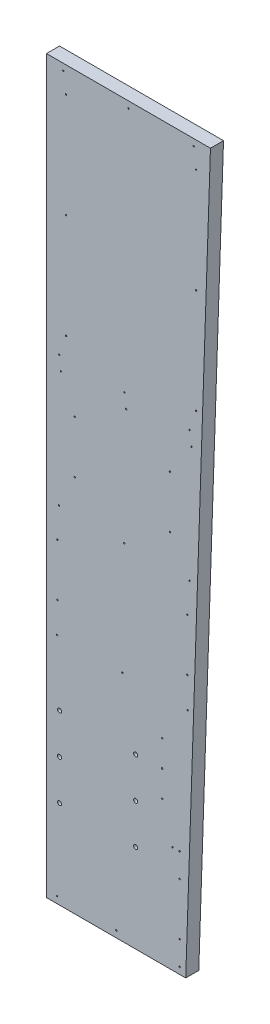
from build123d import *

# Parameters (mm, degrees)
STOCK_LEFT_START                    = 2664.46
STOCK_LEFT_CONSOLE_1_OUTLINE_R      = 2.286
STOCK_LEFT_CONSOLE_1_OUTLINE_R_2    = 2.413
STOCK_LEFT_CONSOLE_1_DEPTH          = 19.05
BOSS_EXTRUDE1_DEPTH                 = 19.05
HOLE2_D                             = 1.98374
HOLE2_CSINK_D                       = 10.16
HOLE2_CSINK_ANGLE                   = 82
F_5_64_0_07813_DIAMETER_HOLE1_D     = 1.984502
F_5_64_0_07813_DIAMETER_HOLE1_DEPTH = 38.1
F_5_64_0_07813_DIAMETER_HOLE1_TIP   = 0.59620455
F_15_64_0_23438_DIAMETER_HOLE1_D    = 5.953252


# Read off the part's stored shape, not the designer's step: Stock-Left Console-1
with BuildPart() as part:
    # Stock-Left Console-1 outline → Stock-Left Console-1 (new body)
    with BuildSketch(Plane.XY.offset(STOCK_LEFT_START)):
        Polygon((266.7, 5935.98), (469.880491555, 5935.980000144), (505.978496548, 7002.779994921), (266.7, 7002.779994921), align=None)
        with Locations((292.1, 5974.08)):
            Circle(STOCK_LEFT_CONSOLE_1_OUTLINE_R, mode=Mode.SUBTRACT)
        with Locations((292.1, 5999.48)):
            Circle(STOCK_LEFT_CONSOLE_1_OUTLINE_R, mode=Mode.SUBTRACT)
        with Locations((292.1, 6037.58)):
            Circle(STOCK_LEFT_CONSOLE_1_OUTLINE_R, mode=Mode.SUBTRACT)
        with Locations((292.1, 6062.980000075)):
            Circle(STOCK_LEFT_CONSOLE_1_OUTLINE_R, mode=Mode.SUBTRACT)
        with Locations((317.5, 5974.08)):
            Circle(STOCK_LEFT_CONSOLE_1_OUTLINE_R, mode=Mode.SUBTRACT)
        with Locations((317.5, 6062.980000075)):
            Circle(STOCK_LEFT_CONSOLE_1_OUTLINE_R, mode=Mode.SUBTRACT)
        with Locations((292.1, 6120.129999958)):
            Circle(STOCK_LEFT_CONSOLE_1_OUTLINE_R, mode=Mode.SUBTRACT)
        with Locations((292.1, 6145.529999958)):
            Circle(STOCK_LEFT_CONSOLE_1_OUTLINE_R, mode=Mode.SUBTRACT)
        with Locations((317.5, 6120.129999958)):
            Circle(STOCK_LEFT_CONSOLE_1_OUTLINE_R, mode=Mode.SUBTRACT)
        with Locations((292.1, 6221.73000008)):
            Circle(STOCK_LEFT_CONSOLE_1_OUTLINE_R, mode=Mode.SUBTRACT)
        with Locations((292.1, 6247.130000155)):
            Circle(STOCK_LEFT_CONSOLE_1_OUTLINE_R, mode=Mode.SUBTRACT)
        with Locations((292.1, 6304.280000038)):
            Circle(STOCK_LEFT_CONSOLE_1_OUTLINE_R, mode=Mode.SUBTRACT)
        with Locations((292.1, 6329.680000038)):
            Circle(STOCK_LEFT_CONSOLE_1_OUTLINE_R, mode=Mode.SUBTRACT)
        with Locations((317.5, 6247.130000155)):
            Circle(STOCK_LEFT_CONSOLE_1_OUTLINE_R, mode=Mode.SUBTRACT)
        with Locations((317.5, 6304.280000038)):
            Circle(STOCK_LEFT_CONSOLE_1_OUTLINE_R, mode=Mode.SUBTRACT)
        with Locations((292.1, 6386.830000042)):
            Circle(STOCK_LEFT_CONSOLE_1_OUTLINE_R, mode=Mode.SUBTRACT)
        with Locations((292.1, 6412.230000117)):
            Circle(STOCK_LEFT_CONSOLE_1_OUTLINE_R, mode=Mode.SUBTRACT)
        with Locations((317.5, 6412.230000117)):
            Circle(STOCK_LEFT_CONSOLE_1_OUTLINE_R, mode=Mode.SUBTRACT)
        with Locations((450.85, 5974.080000054)):
            Circle(STOCK_LEFT_CONSOLE_1_OUTLINE_R, mode=Mode.SUBTRACT)
        with Locations((450.85, 5999.48)):
            Circle(STOCK_LEFT_CONSOLE_1_OUTLINE_R, mode=Mode.SUBTRACT)
        with Locations((450.85, 6037.579999958)):
            Circle(STOCK_LEFT_CONSOLE_1_OUTLINE_R, mode=Mode.SUBTRACT)
        with Locations((450.85, 6062.979999958)):
            Circle(STOCK_LEFT_CONSOLE_1_OUTLINE_R, mode=Mode.SUBTRACT)
        with Locations((450.85, 6120.129999928)):
            Circle(STOCK_LEFT_CONSOLE_1_OUTLINE_R, mode=Mode.SUBTRACT)
        with Locations((450.85, 6145.529999873)):
            Circle(STOCK_LEFT_CONSOLE_1_OUTLINE_R, mode=Mode.SUBTRACT)
        with Locations((450.85, 6221.730000038)):
            Circle(STOCK_LEFT_CONSOLE_1_OUTLINE_R, mode=Mode.SUBTRACT)
        with Locations((450.85, 6247.130000038)):
            Circle(STOCK_LEFT_CONSOLE_1_OUTLINE_R, mode=Mode.SUBTRACT)
        with Locations((450.85, 6304.280000008)):
            Circle(STOCK_LEFT_CONSOLE_1_OUTLINE_R, mode=Mode.SUBTRACT)
        with Locations((450.85, 6329.679999954)):
            Circle(STOCK_LEFT_CONSOLE_1_OUTLINE_R, mode=Mode.SUBTRACT)
        with Locations((450.85, 6386.83)):
            Circle(STOCK_LEFT_CONSOLE_1_OUTLINE_R, mode=Mode.SUBTRACT)
        with Locations((450.85, 6412.23)):
            Circle(STOCK_LEFT_CONSOLE_1_OUTLINE_R, mode=Mode.SUBTRACT)
        with Locations((292.1, 6469.379999916)):
            Circle(STOCK_LEFT_CONSOLE_1_OUTLINE_R, mode=Mode.SUBTRACT)
        with Locations((292.1, 6494.779999916)):
            Circle(STOCK_LEFT_CONSOLE_1_OUTLINE_R, mode=Mode.SUBTRACT)
        with Locations((292.1, 6557.6958)):
            Circle(STOCK_LEFT_CONSOLE_1_OUTLINE_R, mode=Mode.SUBTRACT)
        with Locations((292.1, 6583.095800075)):
            Circle(STOCK_LEFT_CONSOLE_1_OUTLINE_R, mode=Mode.SUBTRACT)
        with Locations((317.5, 6469.379999916)):
            Circle(STOCK_LEFT_CONSOLE_1_OUTLINE_R, mode=Mode.SUBTRACT)
        with Locations((317.5, 6583.095800075)):
            Circle(STOCK_LEFT_CONSOLE_1_OUTLINE_R, mode=Mode.SUBTRACT)
        with Locations((304.799999998, 6667.141886848)):
            Circle(STOCK_LEFT_CONSOLE_1_OUTLINE_R_2, mode=Mode.SUBTRACT)
        with Locations((304.799999998, 6692.541886848)):
            Circle(STOCK_LEFT_CONSOLE_1_OUTLINE_R_2, mode=Mode.SUBTRACT)
        with Locations((330.199999998, 6667.141886848)):
            Circle(STOCK_LEFT_CONSOLE_1_OUTLINE_R_2, mode=Mode.SUBTRACT)
        with Locations((330.199999998, 6692.541886848)):
            Circle(STOCK_LEFT_CONSOLE_1_OUTLINE_R_2, mode=Mode.SUBTRACT)
        with Locations((304.8, 6939.27999014)):
            Circle(STOCK_LEFT_CONSOLE_1_OUTLINE_R, mode=Mode.SUBTRACT)
        with Locations((304.8, 6964.679990215)):
            Circle(STOCK_LEFT_CONSOLE_1_OUTLINE_R, mode=Mode.SUBTRACT)
        with Locations((330.2, 6964.679990215)):
            Circle(STOCK_LEFT_CONSOLE_1_OUTLINE_R, mode=Mode.SUBTRACT)
        with Locations((450.85, 6469.37999997)):
            Circle(STOCK_LEFT_CONSOLE_1_OUTLINE_R, mode=Mode.SUBTRACT)
        with Locations((450.85, 6494.779999916)):
            Circle(STOCK_LEFT_CONSOLE_1_OUTLINE_R, mode=Mode.SUBTRACT)
        with Locations((450.85, 6557.6958)):
            Circle(STOCK_LEFT_CONSOLE_1_OUTLINE_R, mode=Mode.SUBTRACT)
        with Locations((450.85, 6583.0958)):
            Circle(STOCK_LEFT_CONSOLE_1_OUTLINE_R, mode=Mode.SUBTRACT)
        with Locations((476.25, 6667.141886848)):
            Circle(STOCK_LEFT_CONSOLE_1_OUTLINE_R, mode=Mode.SUBTRACT)
        with Locations((476.25, 6692.541886848)):
            Circle(STOCK_LEFT_CONSOLE_1_OUTLINE_R, mode=Mode.SUBTRACT)
        with Locations((476.25, 6939.27999014)):
            Circle(STOCK_LEFT_CONSOLE_1_OUTLINE_R, mode=Mode.SUBTRACT)
        with Locations((476.25, 6964.67999014)):
            Circle(STOCK_LEFT_CONSOLE_1_OUTLINE_R, mode=Mode.SUBTRACT)
    extrude(amount=STOCK_LEFT_CONSOLE_1_DEPTH)

    # Sketch1 → Boss-Extrude1 (add)
    with BuildSketch(Plane(origin=(0, 0, 2664.46), x_dir=(-1, 0, 0), z_dir=(0, 0, -1))):
        Polygon((-266.7, 5935.980000036), (-266.7, 7002.779994921), (-505.978496548, 7002.779994921), (-469.880491555, 5935.980000144), align=None)
    extrude(amount=-BOSS_EXTRUDE1_DEPTH)

    # Hole2 (through all)
    with Locations(Plane(origin=(0, 0, 2664.46), x_dir=(-1, 0, 0), z_dir=(0, 0, -1))):
        with Locations((-460.998646187, 5980.429999944), (-386.339248274, 6993.254992531), (-291.089248274, 6993.254992531), (-481.589248274, 6993.254992531), (-380.416362357, 6631.468843414), (-383.115617646, 6611.6708), (-285.166362357, 6631.468843414), (-287.865617646, 6611.6708), (-475.477307398, 6631.468752771), (-478.365617646, 6611.6708), (-380.210913066, 6440.805), (-377.403156211, 6275.705000839), (-450.592518112, 6091.554999951), (-368.611823093, 5945.505000042), (-284.960913066, 6440.805), (-282.153156211, 6275.705000839), (-475.460913066, 6440.805), (-472.653156211, 6275.705000839), (-460.998646187, 6091.555478285), (-282.153156211, 5945.505000042), (-460.998646187, 5945.505000042), (-485.002307398, 6812.735938474), (-295.274999999, 6812.735938475), (-485.002307398, 6965.135938474), (-295.274999999, 6965.135938475), (-295.274999999, 6660.335938474), (-485.002307398, 6660.335938474), (-446.831312422, 6564.3379), (-307.975, 6564.3379), (-307.975, 6488.1379), (-446.831312422, 6488.1379), (-282.575, 6396.355), (-472.231312422, 6396.355), (-472.231312422, 6320.155), (-282.575, 6320.155), (-435.598646187, 6183.629999816), (-435.598646187, 6221.729999816), (-435.598646187, 6145.529999816), (-460.998646187, 6056.629999944)):
            CounterSinkHole(HOLE2_D / 2, HOLE2_CSINK_D / 2, counter_sink_angle=HOLE2_CSINK_ANGLE)

    # 5/64 (0.07813) Diameter Hole1
    with Locations(Plane(origin=(0, 0, 2664.46), x_dir=(-1, 0, 0), z_dir=(0, 0, -1))):
        with Locations((-481.589248274, 6993.254992531), (-386.339248274, 6993.254992531), (-291.089248274, 6993.254992531), (-295.274999999, 6965.135938475), (-295.274999999, 6812.735938475), (-295.274999999, 6660.335938474), (-285.166362357, 6631.468843414), (-475.477307398, 6631.468752771), (-485.002307398, 6660.335938474), (-485.002307398, 6812.735938474), (-485.002307398, 6965.135938474), (-478.365617646, 6611.6708), (-287.865617646, 6611.6708), (-307.975, 6564.3379), (-307.975, 6488.1379), (-284.960913066, 6440.805), (-380.210913066, 6440.805), (-475.460913066, 6440.805), (-446.831312422, 6488.1379), (-446.831312422, 6564.3379), (-472.231312422, 6396.355), (-472.231312422, 6320.155), (-472.653156211, 6275.705000839), (-377.403156211, 6275.705000839), (-282.153156211, 6275.705000839), (-282.575, 6320.155), (-282.575, 6396.355), (-435.598646187, 6221.729999816), (-435.598646187, 6145.529999816), (-450.592518112, 6091.554999951), (-460.998646187, 6091.555478285), (-460.998646187, 6056.629999944), (-460.998646187, 5980.429999944), (-460.998646187, 5945.505000042), (-282.153156211, 5945.505000042), (-368.611823093, 5945.505000042)):
            Hole(F_5_64_0_07813_DIAMETER_HOLE1_D / 2, depth=F_5_64_0_07813_DIAMETER_HOLE1_DEPTH)
            with Locations((0, 0, -(F_5_64_0_07813_DIAMETER_HOLE1_DEPTH + F_5_64_0_07813_DIAMETER_HOLE1_TIP / 2))):  # 118° drill point
                Cone(0, F_5_64_0_07813_DIAMETER_HOLE1_D / 2, F_5_64_0_07813_DIAMETER_HOLE1_TIP, mode=Mode.SUBTRACT)

    # 15/64 (0.23438) Diameter Hole1 (through all)
    with Locations(Plane.XY.offset(2683.51)):
        with Locations((396.875, 6064.992349798), (396.875, 6123.477327316), (396.875, 6181.962305088), (285.75, 6064.992349798), (285.75, 6123.477327316), (285.75, 6181.962305088)):
            Hole(F_15_64_0_23438_DIAMETER_HOLE1_D / 2)


solid = part.part
